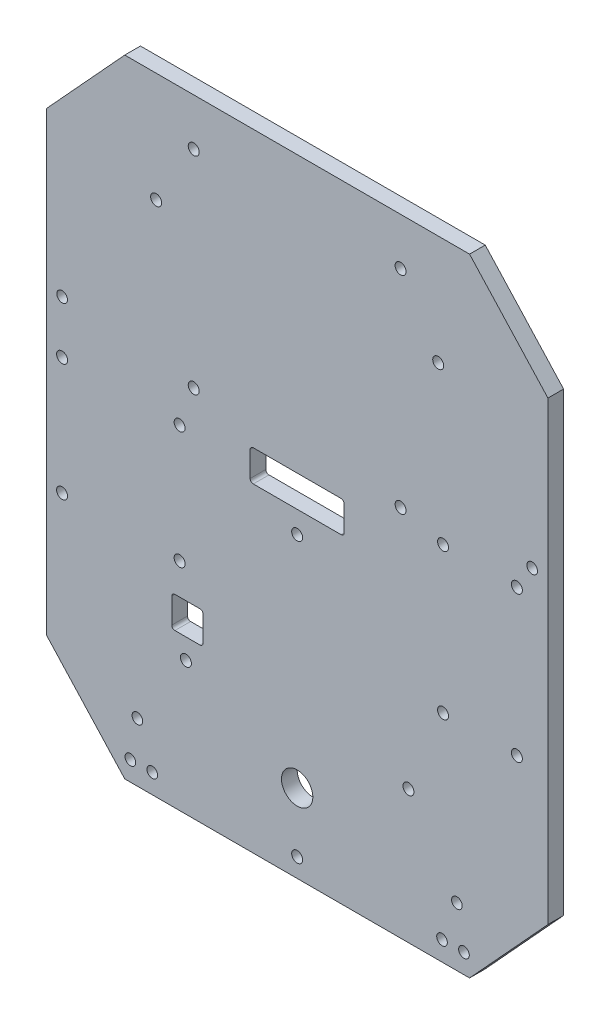
from build123d import *

# Parameters (mm, degrees)
ESQUISSE1_W                    = 200
ESQUISSE1_H                    = 160
ESQUISSE1_R                    = 5
ESQUISSE1_R_2                  = 1.75
ESQUISSE1_W_2                  = 10
ESQUISSE1_H_2                  = 10
ESQUISSE1_H_3                  = 30
BOSS_EXTRU_1_DEPTH             = 5
CONG_2_R                       = 1
ENL_V_MAT_EXTRU_1_DEPTH        = 129.16005618
ESQUISSE3_R                    = 1.75
TROU_CUVE_DIRECTION_DEPTH      = 129.16005618
ESQUISSE4_R                    = 1.7
TROUS_BATTERIES_ET_PIEDS_DEPTH = 129.16005618


with BuildPart() as part:
    # Esquisse1 → Boss.-Extru.1 (new body)
    with BuildSketch(Plane(origin=(0, 0, 0), x_dir=(0, 1, 0), z_dir=(0, 0, 1))):
        Rectangle(ESQUISSE1_W, ESQUISSE1_H)
        with Locations((-75, 0)):
            Circle(ESQUISSE1_R, mode=Mode.SUBTRACT)
        with Locations((-57.5, 35.5)):
            Circle(ESQUISSE1_R_2, mode=Mode.SUBTRACT)
        with Locations((-57.5, -35.5)):
            Circle(ESQUISSE1_R_2, mode=Mode.SUBTRACT)
        with Locations((65, 45)):
            Circle(ESQUISSE1_R_2, mode=Mode.SUBTRACT)
        with Locations((65, -45)):
            Circle(ESQUISSE1_R_2, mode=Mode.SUBTRACT)
        with Locations((-31, 37.5)):
            Circle(ESQUISSE1_R_2, mode=Mode.SUBTRACT)
        with Locations((-31, 75)):
            Circle(ESQUISSE1_R_2, mode=Mode.SUBTRACT)
        with Locations((6.5, 75)):
            Circle(ESQUISSE1_R_2, mode=Mode.SUBTRACT)
        with Locations((6.5, 37.5)):
            Circle(ESQUISSE1_R_2, mode=Mode.SUBTRACT)
        with Locations((-31, -46.541307377)):
            Circle(ESQUISSE1_R_2, mode=Mode.SUBTRACT)
        with Locations((-31, -70.091307377)):
            Circle(ESQUISSE1_R_2, mode=Mode.SUBTRACT)
        with Locations((15.5, -46.541307377)):
            Circle(ESQUISSE1_R_2, mode=Mode.SUBTRACT)
        with Locations((15.5, -70.091307377)):
            Circle(ESQUISSE1_R_2, mode=Mode.SUBTRACT)
        with Locations((-4.999283545, 0)):
            Circle(ESQUISSE1_R_2, mode=Mode.SUBTRACT)
        with Locations((85, 33)):
            Circle(ESQUISSE1_R_2, mode=Mode.SUBTRACT)
        with Locations((85.001189598, -32.999999989)):
            Circle(ESQUISSE1_R_2, mode=Mode.SUBTRACT)
        with Locations((19, 33)):
            Circle(ESQUISSE1_R_2, mode=Mode.SUBTRACT)
        with Locations((19.001189598, -32.999999989)):
            Circle(ESQUISSE1_R_2, mode=Mode.SUBTRACT)
        with Locations((-46, 35)):
            Rectangle(ESQUISSE1_W_2, ESQUISSE1_H_2, mode=Mode.SUBTRACT)
        with Locations((7, 0)):
            Rectangle(ESQUISSE1_W_2, ESQUISSE1_H_3, mode=Mode.SUBTRACT)
    extrude(amount=BOSS_EXTRU_1_DEPTH)

    # Congé2
    cong_2_edges = [part.edges().sort_by_distance(p)[0] for p in [
        (-30, -51, 2.5),
        (-30, -41, 2.5),
        (-40, -41, 2.5),
        (-40, -51, 2.5),
        (15, 2, 2.5),
        (15, 12, 2.5),
        (-15, 12, 2.5),
        (-15, 2, 2.5),
    ]]
    fillet(cong_2_edges, radius=CONG_2_R)

    # Esquisse2 → Enlèv. mat.-Extru.1 (cut, through all)
    with BuildSketch(Plane.XY.offset(5)):
        Polygon((-573.580399643, 598.167108478), (-698.698151963, -488.082468479), (684.299979338, -647.380682556), (762.904681953, 702.431902078), align=None)
        Polygon((-110, 40), (0, 160), (110, 40), (110, -40), (0, -160), (-110, -40), align=None, mode=Mode.SUBTRACT)
    extrude(amount=-ENL_V_MAT_EXTRU_1_DEPTH, mode=Mode.SUBTRACT)

    # Esquisse3 → Trou cuve direction (cut, through all)
    with BuildSketch(Plane(origin=(0, 0, 0), x_dir=(0, 1, 0), z_dir=(0, 0, 1))):
        with Locations((-94.001515359, 0.004041019)):
            Circle(ESQUISSE3_R)
    extrude(amount=TROU_CUVE_DIRECTION_DEPTH, mode=Mode.SUBTRACT)

    # Esquisse4 → Trous batteries et pieds (cut, through all)
    with BuildSketch(Plane.XY.offset(5)):
        with Locations((-50.974041019, -81.261515359)):
            Circle(ESQUISSE4_R)
        with Locations((-74.974041019, 23.238484641)):
            Circle(ESQUISSE4_R)
        with Locations((50.965958981, -81.261515359)):
            Circle(ESQUISSE4_R)
        with Locations((74.965958981, 23.238484641)):
            Circle(ESQUISSE4_R)
        with Locations((-53.224041019, -93.761515359)):
            Circle(ESQUISSE4_R)
        with Locations((46.215958981, -93.761515359)):
            Circle(ESQUISSE4_R)
        with Locations((-46.224041019, -93.761515359)):
            Circle(ESQUISSE4_R)
        with Locations((53.215958981, -93.761515359)):
            Circle(ESQUISSE4_R)
    extrude(amount=-TROUS_BATTERIES_ET_PIEDS_DEPTH, mode=Mode.SUBTRACT)


solid = part.part
